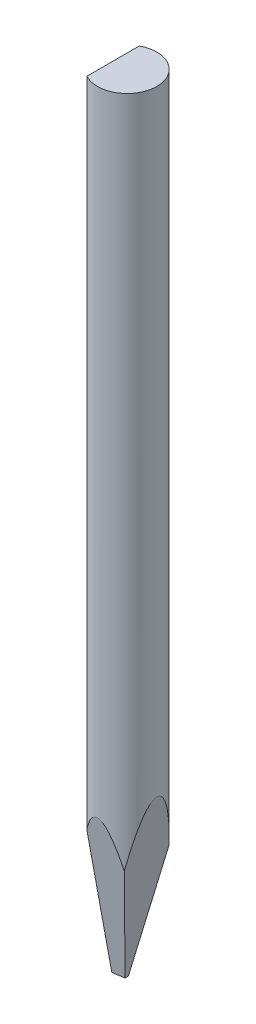
from build123d import *

# Parameters (mm, degrees)
TD_SKETCH_R                   = 0.792499939
TL_FEATURE_DEPTH              = 20.99999991
TDF_STD_SKETCH_W              = 1.604999838
TDF_STD_SKETCH_H              = 1.604999838
TDF_STD_FEATURE_DEPTH         = 22.02988608
ISA_20_STD_FEATURE_DEPTH      = 22.02988608
ISA_20_STD_FEATURE_DEPTH_BACK = 22.02988608
F_10BA_STD_FEATURE_DEPTH      = 22.02988608
F_10BA_STD_FEATURE_DEPTH_BACK = 22.02988608


with BuildPart() as part:
    # TD_sketch → TL_feature (new body)
    with BuildSketch(Plane(origin=(0, 0, 0), x_dir=(1, 0, 0), z_dir=(0, 1, 0))):
        Circle(TD_SKETCH_R)
    extrude(amount=TL_FEATURE_DEPTH)

    # TDF_STD_sketch → TDF_STD_feature (cut, through all)
    with BuildSketch(Plane(origin=(0, 0, 0), x_dir=(1, 0, 0), z_dir=(0, 1, 0))):
        with Locations((-1.17799993, 0)):
            Rectangle(TDF_STD_SKETCH_W, TDF_STD_SKETCH_H)
    extrude(amount=TDF_STD_FEATURE_DEPTH, mode=Mode.SUBTRACT)

    # ISA_20_STD_sketch → ISA_20_STD_feature (cut, two sides: drawn at the far end of the back side and taken through both)
    with BuildSketch(Plane(origin=(0, 0, 0), x_dir=(0, 0, -1), z_dir=(1, 0, 0)).offset(-ISA_20_STD_FEATURE_DEPTH_BACK)):
        Polygon((-13.462346915, 73.159859471), (-3.889221277, 20.99999991), (-0.035000057, 0), (0.035000057, 0), (3.889221277, 20.99999991), (13.462346915, 73.159859471), (13.462346915, -32.902305016), (-13.462346915, -32.902305016), align=None)
    extrude(amount=ISA_20_STD_FEATURE_DEPTH + ISA_20_STD_FEATURE_DEPTH_BACK, mode=Mode.SUBTRACT)

    # 10BA_STD_sketch → 10BA_STD_feature (cut, two sides: drawn at the far end of the back side and taken through both)
    with BuildSketch(Plane.XY.offset(-F_10BA_STD_FEATURE_DEPTH_BACK)):
        Polygon((-53.152802148, 0), (-0.375500011, 0), (-0.289499929, 0), (-0.010835963, 0.049135976), (3.683366618, 20.99999991), (12.848048956, 72.975496238), (91.13369141, 2.172017021), (25.132840305, -70.803479216), align=None)
    extrude(amount=F_10BA_STD_FEATURE_DEPTH + F_10BA_STD_FEATURE_DEPTH_BACK, mode=Mode.SUBTRACT)


solid = part.part
